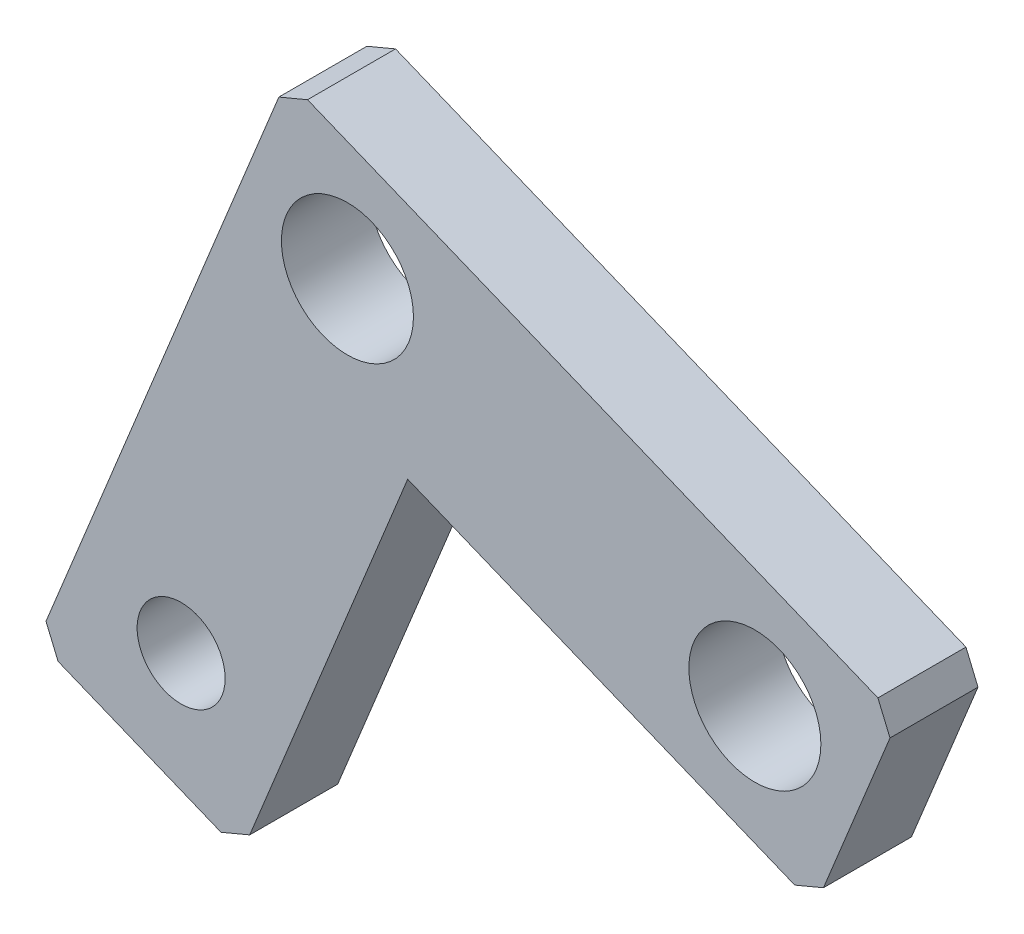
from build123d import *

# Parameters (mm, degrees)
SKETCH_1_R      = 7.5
SKETCH_1_R_2    = 5
EXTRUDE_1_DEPTH = 10
CHAMFER_1_SIZE  = 2.5


with BuildPart() as part:
    # 草圖1 → 填料-伸長1 (new body)
    with BuildSketch(Plane.XY):
        Polygon((-42.684704159, 14.950876454), (26.753169389, -13.39311263), (17.305173028, -36.539070479), (-28.986742671, -17.643077757), (-47.882735393, -63.934993455), (-71.028693242, -54.486997094), align=None)
        with Locations((10.456192284, -20.242093374)):
            Circle(SKETCH_1_R, mode=Mode.SUBTRACT)
        with Locations((-35.835723415, -1.346100652)):
            Circle(SKETCH_1_R, mode=Mode.SUBTRACT)
        with Locations((-54.731716137, -47.63801635)):
            Circle(SKETCH_1_R_2, mode=Mode.SUBTRACT)
    extrude(amount=-EXTRUDE_1_DEPTH)

    # 導角1
    chamfer_1_edges = [part.edges().sort_by_distance(p)[0] for p in [
        (-47.882735393, -63.934993455, -5),
        (17.305173028, -36.539070479, -5),
        (26.753169389, -13.39311263, -5),
        (-71.028693242, -54.486997094, -5),
        (-42.684704159, 14.950876454, -5),
    ]]
    chamfer(chamfer_1_edges, length=CHAMFER_1_SIZE)


solid = part.part
